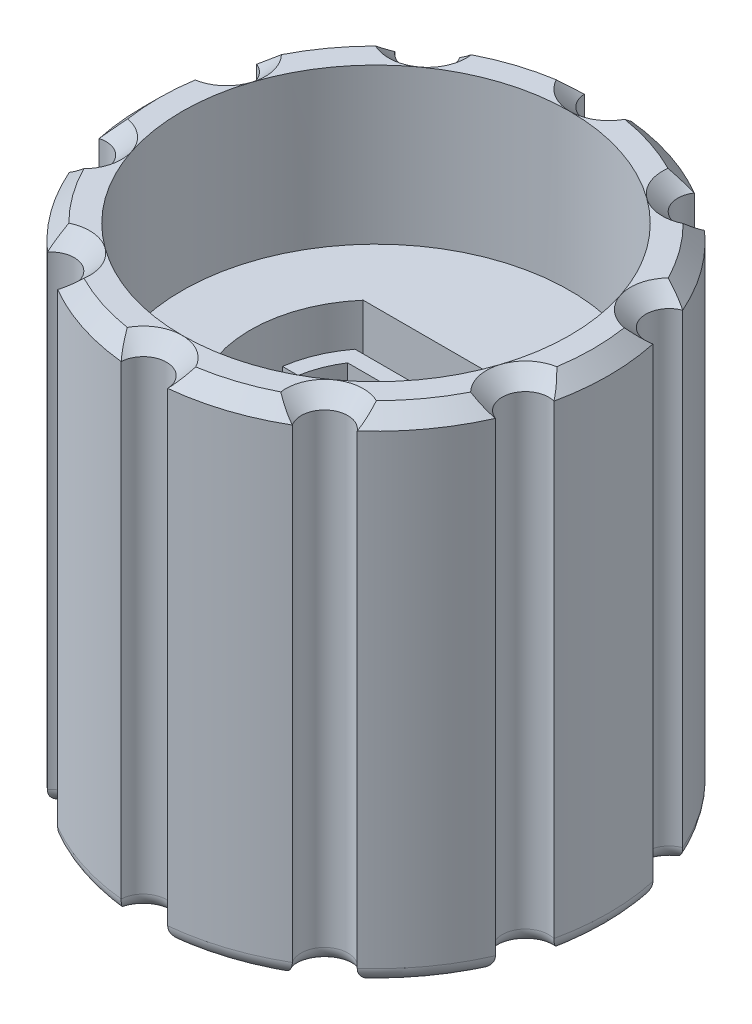
from build123d import *

# Parameters (mm, degrees)
SKETCH1_R           = 7.5
BOSS_EXTRUDE1_DEPTH = 16
CUT_EXTRUDE3_DEPTH  = 20.19635382
CHAMFER1_SIZE       = 0.5
FILLET1_R           = 0.5
CUT_EXTRUDE4_DEPTH  = 14
BOSS_EXTRUDE2_DEPTH = 8
SKETCH7_R           = 6.25
CUT_EXTRUDE5_DEPTH  = 5


with BuildPart() as part:
    # Sketch1 → Boss-Extrude1 (new body)
    with BuildSketch(Plane(origin=(0, 0, 0), x_dir=(1, 0, 0), z_dir=(0, 1, 0))):
        Circle(SKETCH1_R)
    extrude(amount=BOSS_EXTRUDE1_DEPTH)

    # Sketch4 → Cut-Extrude3 (cut, through all)
    with BuildSketch(Plane(origin=(0, 16, 0), x_dir=(1, 0, 0), z_dir=(0, 1, 0))):
        with BuildLine():
            ThreePointArc((-0.749061913, -7.4625), (0, -7.5), (0.749061913, -7.4625))
            ThreePointArc((0.749061913, -7.4625), (0, -6.75), (-0.749061913, -7.4625))
        make_face()
        with BuildLine():
            ThreePointArc((4.992351263, -5.597001775), (3.967550453, -5.460864712), (3.780343628, -6.477576866))
            ThreePointArc((3.780343628, -6.477576866), (4.408389392, -6.067627458), (4.992351263, -5.597001775))
        make_face()
        with BuildLine():
            ThreePointArc((-4.992351263, -5.597001775), (-4.408389392, -6.067627458), (-3.780343628, -6.477576866))
            ThreePointArc((-3.780343628, -6.477576866), (-3.967550453, -5.460864712), (-4.992351263, -5.597001775))
        make_face()
        with BuildLine():
            ThreePointArc((7.328732114, -1.593639107), (6.419631485, -2.085864712), (6.865786392, -3.018439534))
            ThreePointArc((6.865786392, -3.018439534), (7.132923872, -2.317627458), (7.328732114, -1.593639107))
        make_face()
        with BuildLine():
            ThreePointArc((-7.328732114, -1.593639107), (-7.132923872, -2.317627458), (-6.865786392, -3.018439534))
            ThreePointArc((-6.865786392, -3.018439534), (-6.419631485, -2.085864712), (-7.328732114, -1.593639107))
        make_face()
        with BuildLine():
            ThreePointArc((-6.865786392, 3.018439534), (-7.132923872, 2.317627458), (-7.328732114, 1.593639107))
            ThreePointArc((-7.328732114, 1.593639107), (-6.419631485, 2.085864712), (-6.865786392, 3.018439534))
        make_face()
        with BuildLine():
            ThreePointArc((6.865786392, 3.018439534), (6.419631485, 2.085864712), (7.328732114, 1.593639107))
            ThreePointArc((7.328732114, 1.593639107), (7.132923872, 2.317627458), (6.865786392, 3.018439534))
        make_face()
        with BuildLine():
            ThreePointArc((-3.780343628, 6.477576866), (-4.408389392, 6.067627458), (-4.992351263, 5.597001775))
            ThreePointArc((-4.992351263, 5.597001775), (-3.967550453, 5.460864712), (-3.780343628, 6.477576866))
        make_face()
        with BuildLine():
            ThreePointArc((3.780343628, 6.477576866), (3.967550453, 5.460864712), (4.992351263, 5.597001775))
            ThreePointArc((4.992351263, 5.597001775), (4.408389392, 6.067627458), (3.780343628, 6.477576866))
        make_face()
        with BuildLine():
            ThreePointArc((0.749061913, 7.4625), (0, 7.5), (-0.749061913, 7.4625))
            ThreePointArc((-0.749061913, 7.4625), (0, 6.75), (0.749061913, 7.4625))
        make_face()
    extrude(amount=-CUT_EXTRUDE3_DEPTH, mode=Mode.SUBTRACT)

    # Chamfer1
    chamfer1_edges = [part.edges().sort_by_distance(p)[0] for p in [
        (-3.967550453, 16, 5.460864712),
        (-6.067627458, 16, 4.408389392),
        (-6.419631485, 16, 2.085864712),
        (-7.5, 16, 0),
        (-6.419631485, 16, -2.085864712),
        (-6.067627458, 16, -4.408389392),
        (-3.967550453, 16, -5.460864712),
        (-2.317627458, 16, -7.132923872),
        (0, 16, -6.75),
        (2.317627458, 16, -7.132923872),
        (3.967550453, 16, -5.460864712),
        (6.067627458, 16, -4.408389392),
        (6.419631485, 16, -2.085864712),
        (7.5, 16, 0),
        (6.419631485, 16, 2.085864712),
        (6.067627458, 16, 4.408389392),
        (3.967550453, 16, 5.460864712),
        (2.317627458, 16, 7.132923872),
        (0, 16, 6.75),
        (-2.317627458, 16, 7.132923872),
    ]]
    chamfer(chamfer1_edges, length=CHAMFER1_SIZE)

    # Fillet1
    fillet1_edges = [part.edges().sort_by_distance(p)[0] for p in [
        (-3.967550453, 0, 5.460864712),
        (-2.317627458, 0, 7.132923872),
        (0, 0, 6.75),
        (2.317627458, 0, 7.132923872),
        (3.967550453, 0, 5.460864712),
        (6.067627458, 0, 4.408389392),
        (6.419631485, 0, 2.085864712),
        (7.5, 0, 0),
        (6.419631485, 0, -2.085864712),
        (6.067627458, 0, -4.408389392),
        (3.967550453, 0, -5.460864712),
        (2.317627458, 0, -7.132923872),
        (0, 0, -6.75),
        (-2.317627458, 0, -7.132923872),
        (-3.967550453, 0, -5.460864712),
        (-6.067627458, 0, -4.408389392),
        (-6.419631485, 0, -2.085864712),
        (-7.5, 0, 0),
        (-6.419631485, 0, 2.085864712),
        (-6.067627458, 0, 4.408389392),
    ]]
    fillet(fillet1_edges, radius=FILLET1_R)

    # Sketch5 → Cut-Extrude4 (cut)
    with BuildSketch(Plane(origin=(0, 16, 0), x_dir=(1, 0, 0), z_dir=(0, 1, 0))):
        with BuildLine():
            Line((-3.062678566, 2.65), (3.062678566, 2.65))
            ThreePointArc((3.062678566, 2.65), (0, -4.05), (-3.062678566, 2.65))
        make_face()
    extrude(amount=-CUT_EXTRUDE4_DEPTH, mode=Mode.SUBTRACT)

    # Sketch6 → Boss-Extrude2 (add)
    with BuildSketch(Plane(origin=(0, 2, 0), x_dir=(1, 0, 0), z_dir=(0, 1, 0))):
        with BuildLine():
            Line((2.824889378, 2.15), (-2.824889378, 2.15))
            ThreePointArc((-2.824889378, 2.15), (-3.275354264, 1.369143691), (-3.514612354, 0.5))
            Line((-3.514612354, 0.5), (-3.008737277, 0.5))
            ThreePointArc((-3.008737277, 0.5), (-2.845642778, 1.097641645), (-2.565151068, 1.65))
            Line((-2.565151068, 1.65), (2.565151068, 1.65))
            ThreePointArc((2.565151068, 1.65), (2.845642778, 1.097641645), (3.008737277, 0.5))
            Line((3.008737277, 0.5), (3.514612354, 0.5))
            ThreePointArc((3.514612354, 0.5), (3.275354264, 1.369143691), (2.824889378, 2.15))
        make_face()
        with BuildLine():
            Line((-3.55, 0), (-3.05, 0))
            ThreePointArc((-3.05, 0), (0, -3.05), (3.05, 0))
            Line((3.05, 0), (3.55, 0))
            ThreePointArc((3.55, 0), (0, -3.55), (-3.55, 0))
        make_face()
    extrude(amount=BOSS_EXTRUDE2_DEPTH)

    # Sketch7 → Cut-Extrude5 (cut)
    with BuildSketch(Plane(origin=(0, 16, 0), x_dir=(1, 0, 0), z_dir=(0, 1, 0))):
        Circle(SKETCH7_R)
        with BuildLine():
            Line((3.062678566, 2.65), (-3.062678566, 2.65))
            ThreePointArc((-3.062678566, 2.65), (0, -4.05), (3.062678566, 2.65))
        make_face(mode=Mode.SUBTRACT)
    extrude(amount=-CUT_EXTRUDE5_DEPTH, mode=Mode.SUBTRACT)


solid = part.part
